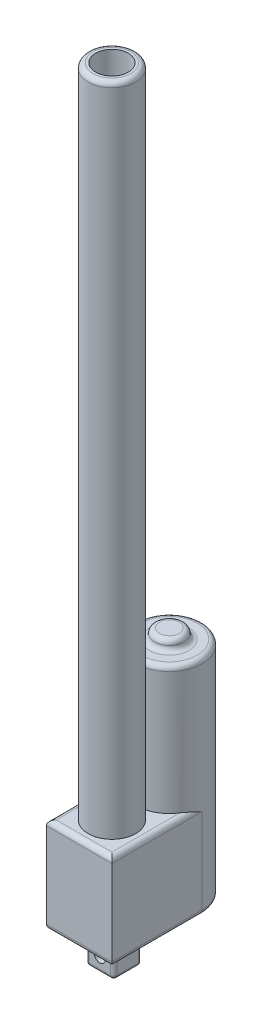
from build123d import *

# Parameters (mm, degrees)
EXTRUDE_1_DEPTH     = 58
SKETCH_2_R          = 20
EXTRUDE_7_DEPTH     = 78
SKETCH_3_R          = 14.5
EXTRUDE_8_DEPTH     = 400
SKETCH_4_R          = 10
CUT_EXTRUDE_1_DEPTH = 300
FILLET_2_R          = 3
FILLET_START        = -21
FILLET_3_DEPTH      = 77
FILLET_3_2_DEPTH    = 41
FILLET_3_3_ANGLE    = 180
FILLET_4_R          = 3
SKETCH_6_R          = 9
EXTRUDE_10_DEPTH    = 6
FILLET_5_R          = 3
FILLET_6_R          = 3
EXTRUDE_11_DEPTH    = 18
FILLET_7_R          = 2
SKETCH_9_R          = 3.25
CUT_EXTRUDE_2_DEPTH = 463.813407343


with BuildPart() as part:
    # 草图1 → 凸台-拉伸1 (new body)
    with BuildSketch(Plane(origin=(0, 0, 0), x_dir=(1, 0, 0), z_dir=(0, 1, 0))):
        with BuildLine():
            Line((20, 0), (20, -55))
            Line((20, -55), (-20, -55))
            Line((-20, -55), (-20, 0))
            ThreePointArc((-20, 0), (0, 20), (20, 0))
        make_face()
    extrude(amount=EXTRUDE_1_DEPTH)

    # 草图2 → 凸台-拉伸7 (add)
    with BuildSketch(Plane(origin=(0, 58, 0), x_dir=(1, 0, 0), z_dir=(0, 1, 0))):
        with Locations(Location((0, 0, 0), (0, 0, 180))):
            Circle(SKETCH_2_R)
    extrude(amount=EXTRUDE_7_DEPTH)

    # 草图3 → 凸台-拉伸8 (add)
    with BuildSketch(Plane(origin=(0, 58, 0), x_dir=(1, 0, 0), z_dir=(0, 1, 0))):
        with Locations(Location((0, -35, 0), (0, 0, 270))):
            Circle(SKETCH_3_R)
    extrude(amount=EXTRUDE_8_DEPTH)

    # 草图4 → 切除-拉伸1 (cut)
    with BuildSketch(Plane(origin=(0, 458, 0), x_dir=(1, 0, 0), z_dir=(0, 1, 0))):
        with Locations(Location((0, -35, 0), (0, 0, 270))):
            Circle(SKETCH_4_R)
    extrude(amount=-CUT_EXTRUDE_1_DEPTH, mode=Mode.SUBTRACT)

    # 圆角2
    # the kernel refuses this fillet: 3 mm, written as the material it takes off along each edge
    with BuildSketch(Plane(origin=(27.5, 58, 55), x_dir=(0, -1, 0), z_dir=(-1, 0, 0))) as fillet_2_piece_1:
        with BuildLine():
            CenterArc((FILLET_2_R, -FILLET_2_R), FILLET_2_R, 90, 90)
            Line((0, -FILLET_2_R), (0, 0))
            Line((0, 0), (FILLET_2_R, 0))
        make_face()
    extrude(amount=55, mode=Mode.SUBTRACT)
    with BuildSketch(Plane(origin=(20, 58, -12.75), x_dir=(0, -1, 0), z_dir=(0, 0, 1))) as fillet_2_piece_2_section:
        with BuildLine():
            CenterArc((FILLET_2_R, -FILLET_2_R), FILLET_2_R, 90, 90)
            Line((0, -FILLET_2_R), (0, 0))
            Line((0, 0), (FILLET_2_R, 0))
        make_face()
    fillet_2_piece_2 = extrude(amount=75.25, mode=Mode.PRIVATE)
    fillet_2_piece_2 = fillet_2_piece_2 - Plane(origin=(0, 58, 0), x_dir=(-1, 0, 0), z_dir=(0, -1, 0)) * Cylinder(20, 163, mode=Mode.PRIVATE)
    add(fillet_2_piece_2, mode=Mode.SUBTRACT)
    with BuildSketch(Plane(origin=(-20, 58, 62.5), x_dir=(1, 0, 0), z_dir=(0, 0, -1))) as fillet_2_piece_3_section:
        with BuildLine():
            CenterArc((FILLET_2_R, FILLET_2_R), FILLET_2_R, 180, 90)
            Line((0, FILLET_2_R), (0, 0))
            Line((0, 0), (FILLET_2_R, 0))
        make_face()
    fillet_2_piece_3 = extrude(amount=75.25, mode=Mode.PRIVATE)
    fillet_2_piece_3 = fillet_2_piece_3 - Plane(origin=(0, 58, 0), x_dir=(-1, 0, 0), z_dir=(0, -1, 0)) * Cylinder(20, 163, mode=Mode.PRIVATE)
    add(fillet_2_piece_3, mode=Mode.SUBTRACT)

    # 圆角3: read off the stored shape, not the designer's step
    # 圆角3 outline → 圆角3 (cut)
    with BuildSketch(Plane.XY.offset(FILLET_START)):
        with BuildLine():
            Line((20, 0), (20, 3))
            ThreePointArc((20, 3), (19.121320344, 0.878679656), (17, 0))
            Line((17, 0), (20, 0))
        make_face()
        with BuildLine():
            Line((-20, 0), (-17, 0))
            ThreePointArc((-17, 0), (-19.121320344, 0.878679656), (-20, 3))
            Line((-20, 3), (-20, 0))
        make_face()
    extrude(amount=FILLET_3_DEPTH, mode=Mode.SUBTRACT)

    # Fillet 3 2 outline → Fillet 3 2 (cut)
    with BuildSketch(Plane.YZ.offset(FILLET_START)):
        with BuildLine():
            ThreePointArc((0, 52), (0.878679656, 54.121320344), (3, 55))
            Line((3, 55), (0, 55))
            Line((0, 55), (0, 52))
        make_face()
    extrude(amount=FILLET_3_2_DEPTH, mode=Mode.SUBTRACT)

    # Fillet 3 3 outline → Fillet 3 3 (revolve, cut)
    with BuildSketch(Plane.XY):
        with BuildLine():
            ThreePointArc((20, 3), (19.121320344, 0.878679656), (17, 0))
            Line((17, 0), (20, 0))
            Line((20, 0), (20, 3))
        make_face()
    revolve(axis=Axis((0, 0, 0), (0, 1, 0)), revolution_arc=FILLET_3_3_ANGLE, mode=Mode.SUBTRACT)

    # 圆角4
    fillet_4_edges = [part.edges().sort_by_distance(p)[0] for p in [
        (20, 136, 0),
    ]]
    fillet(fillet_4_edges, radius=FILLET_4_R)

    # 草图6 → 凸台-拉伸10 (add)
    with BuildSketch(Plane(origin=(0, 136, 0), x_dir=(1, 0, 0), z_dir=(0, 1, 0))):
        with Locations(Location((0, 0, 0), (0, 0, 270))):
            Circle(SKETCH_6_R)
    extrude(amount=EXTRUDE_10_DEPTH)

    # 圆角5
    fillet_5_edges = [part.edges().sort_by_distance(p)[0] for p in [
        (0, 136, -9),
        (0, 142, -9),
    ]]
    fillet(fillet_5_edges, radius=FILLET_5_R - 0.0001)  # a hair under: the kernel refuses the full size

    # 圆角6
    fillet_6_edges = [part.edges().sort_by_distance(p)[0] for p in [
        (0, 458, 20.5),
    ]]
    fillet(fillet_6_edges, radius=FILLET_6_R)

    # 草图7 → 凸台-拉伸11 (add)
    with BuildSketch(Plane.XZ):
        with BuildLine():
            Line((-5.404550966, 43.5), (7.595449034, 43.5))
            ThreePointArc((7.595449034, 43.5), (9.009662596, 42.914213562), (9.595449034, 41.5))
            Line((9.595449034, 41.5), (9.595449034, 28.5))
            ThreePointArc((9.595449034, 28.5), (9.009662596, 27.085786438), (7.595449034, 26.5))
            Line((7.595449034, 26.5), (-5.404550966, 26.5))
            ThreePointArc((-5.404550966, 26.5), (-6.818764529, 27.085786438), (-7.404550966, 28.5))
            Line((-7.404550966, 28.5), (-7.404550966, 41.5))
            ThreePointArc((-7.404550966, 41.5), (-6.818764529, 42.914213562), (-5.404550966, 43.5))
        make_face()
    extrude(amount=EXTRUDE_11_DEPTH)

    # 圆角7
    fillet_7_edges = [part.edges().sort_by_distance(p)[0] for p in [
        (-6.818764529, -18, 42.914213562),
        (-7.404550966, -18, 35),
        (-6.818764529, -18, 27.085786438),
        (1.095449034, -18, 26.5),
        (9.009662596, -18, 27.085786438),
        (9.595449034, -18, 35),
        (9.009662596, -18, 42.914213562),
        (1.095449034, -18, 43.5),
    ]]
    fillet(fillet_7_edges, radius=FILLET_7_R)

    # 草图9 → 切除-拉伸2 (cut, through all)
    with BuildSketch(Plane.XY.offset(43.5)):
        with Locations((1.095449034, -9.5)):
            Circle(SKETCH_9_R)
    extrude(amount=-CUT_EXTRUDE_2_DEPTH, mode=Mode.SUBTRACT)


solid = part.part
